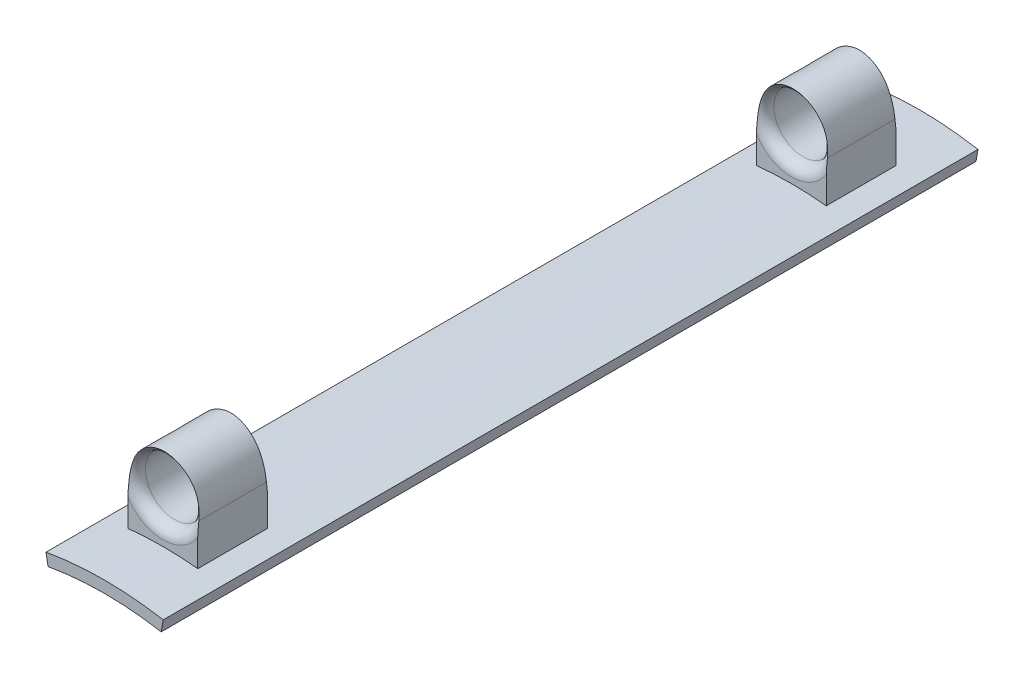
from build123d import *

# Parameters (mm, degrees)
EXTRUIR_L_MINA1_DEPTH      = 70
SALIENTE_EXTRUIR1_START    = -0.15559
CROQUIS2_W                 = 6
CROQUIS2_H                 = 6
SALIENTE_EXTRUIR1_DEPTH    = 7.15559
CORTAR_EXTRUIR2_DEPTH      = 66.683782267
CORTAR_EXTRUIR2_DEPTH_BACK = 66.683782267
CORTAR_EXTRUIR3_REACH      = 67.684
CROQUIS5_R                 = 2.5
REDONDEO1_R                = 1


with BuildPart() as part:
    # Croquis1 → Extruir-Lámina1 (new body)
    with BuildSketch(Plane.XY):
        with BuildLine():
            ThreePointArc((-4.862148975, -0.425382916), (0, 0), (4.862148975, -0.425382916))
            Line((4.862148975, -0.425382916), (5.035797152, 0.559424837))
            ThreePointArc((5.035797152, 0.559424837), (0, 1), (-5.035797152, 0.559424837))
            Line((-5.035797152, 0.559424837), (-4.862148975, -0.425382916))
        make_face()
    extrude(amount=-EXTRUIR_L_MINA1_DEPTH)

    # Croquis2 → Saliente-Extruir1 (add)
    with BuildSketch(Plane(origin=(0, 1, 0), x_dir=(1, 0, 0), z_dir=(0, 1, 0)).offset(SALIENTE_EXTRUIR1_START)):
        with Locations((0, 62)):
            Rectangle(CROQUIS2_W, CROQUIS2_H)
        with Locations((0, 8)):
            Rectangle(CROQUIS2_W, CROQUIS2_H)
    extrude(amount=SALIENTE_EXTRUIR1_DEPTH)

    # Croquis4 → Cortar-Extruir2 (cut, two sides: drawn at the far end of the back side and taken through both)
    with BuildSketch(Plane.XY.offset(-5).offset(-CORTAR_EXTRUIR2_DEPTH_BACK)):
        with BuildLine():
            Line((-3, 8), (-3, 4.344410204))
            add(Edge.make_bspline(
                [(-3, 4.344410204), (-3, 6.713646538), (-1.432580492, 7.892870004), (-0.130234552, 8.000000003), (6.1e-08, 8)],
                knots=[0, 0, 0, 0, 0.45, 0.500000008, 0.500000008, 0.500000008, 0.500000008], degree=3))
            Line((6.1e-08, 8), (-3, 8))
        make_face()
        with BuildLine():
            Line((3, 8), (6.1e-08, 8))
            add(Edge.make_bspline(
                [(6.1e-08, 8), (0.130234633, 7.999999997), (1.432580541, 7.892869967), (3, 6.715233106), (3, 4.344410204)],
                knots=[0.500000008, 0.500000008, 0.500000008, 0.500000008, 0.55, 1, 1, 1, 1], degree=3))
            Line((3, 4.344410204), (3, 8))
        make_face()
    extrude(amount=CORTAR_EXTRUIR2_DEPTH + CORTAR_EXTRUIR2_DEPTH_BACK, mode=Mode.SUBTRACT)

    # Cortar-Extruir3: up to this face of the body (flat: up to its plane)
    cortar_extruir3_end = Plane(part.part.faces().sort_by_distance((6.0636e-05, 4.150100926, -65))[0])
    # Croquis5 → Cortar-Extruir3 (cut, up to the picked face)
    with BuildSketch(Plane.XY.offset(-5), mode=Mode.PRIVATE) as cortar_extruir3_sk1:
        with Locations((0, 5)):
            Circle(CROQUIS5_R)
    cortar_extruir3_tool1 = split(extrude(cortar_extruir3_sk1.sketch, amount=-CORTAR_EXTRUIR3_REACH, mode=Mode.PRIVATE), bisect_by=cortar_extruir3_end, keep=Keep.BOTH, mode=Mode.PRIVATE)
    add(cortar_extruir3_tool1.solids().sort_by(Axis((0, 5, -5), (0, 0, -1)))[0], mode=Mode.SUBTRACT)

    # Redondeo1
    # the kernel refuses this fillet: 1 mm, written as the material it takes off along each edge
    with BuildSketch(Plane(origin=(0, 5, -59), x_dir=(1, 0, 0), z_dir=(0, -1, 0))) as redondeo1_piece_1:
        with BuildLine():
            CenterArc((2.5 + REDONDEO1_R, -REDONDEO1_R), REDONDEO1_R, 90, 90)
            Line((2.5, -REDONDEO1_R), (2.5, 0))
            Line((2.5, 0), (2.5 + REDONDEO1_R, 0))
        make_face()
    revolve(axis=Axis((0, 5, -59), (0, 0, 1)), mode=Mode.SUBTRACT)
    with BuildSketch(Plane(origin=(0, 5, -65), x_dir=(1, 0, 0), z_dir=(0, -1, 0))) as redondeo1_piece_2:
        with BuildLine():
            CenterArc((2.5 + REDONDEO1_R, REDONDEO1_R), REDONDEO1_R, 180, 90)
            Line((2.5, REDONDEO1_R), (2.5, 0))
            Line((2.5, 0), (2.5 + REDONDEO1_R, 0))
        make_face()
    revolve(axis=Axis((0, 5, -65), (0, 0, 1)), mode=Mode.SUBTRACT)
    with BuildSketch(Plane(origin=(0, 5, -11), x_dir=(1, 0, 0), z_dir=(0, -1, 0))) as redondeo1_piece_3:
        with BuildLine():
            CenterArc((2.5 + REDONDEO1_R, REDONDEO1_R), REDONDEO1_R, 180, 90)
            Line((2.5, REDONDEO1_R), (2.5, 0))
            Line((2.5, 0), (2.5 + REDONDEO1_R, 0))
        make_face()
    revolve(axis=Axis((0, 5, -11), (0, 0, 1)), mode=Mode.SUBTRACT)
    with BuildSketch(Plane(origin=(0, 5, -5), x_dir=(1, 0, 0), z_dir=(0, -1, 0))) as redondeo1_piece_4:
        with BuildLine():
            CenterArc((2.5 + REDONDEO1_R, -REDONDEO1_R), REDONDEO1_R, 90, 90)
            Line((2.5, -REDONDEO1_R), (2.5, 0))
            Line((2.5, 0), (2.5 + REDONDEO1_R, 0))
        make_face()
    revolve(axis=Axis((0, 5, -5), (0, 0, 1)), mode=Mode.SUBTRACT)


solid = part.part
